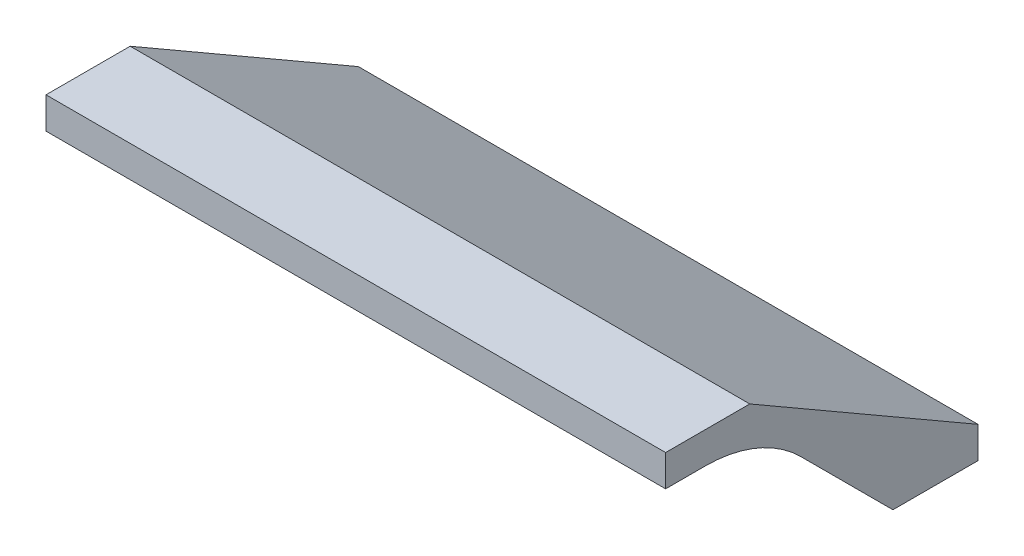
from build123d import *

# Parameters (mm, degrees)
BOSS_EXTRUDE1_DEPTH = 500
CUT_EXTRUDE1_DEPTH  = 570.957034721
SKETCH3_W           = 88.9
SKETCH3_H           = 25.400000016
BOSS_EXTRUDE2_DEPTH = 1
SKETCH4_W           = 88.9
SKETCH4_H           = 25.40000001
BOSS_EXTRUDE3_DEPTH = 1
FILLET1_R           = 109.330995043


with BuildPart() as part:
    # Sketch1 → Boss-Extrude1 (new body)
    with BuildSketch(Plane(origin=(-250, 0, 0), x_dir=(0, -1, 0), z_dir=(-1, 0, 0))):
        Polygon((106.330251065, -252.08113602), (106.330251065, 0), (-25.401284991, 0), (-25.401284991, -67.909513139), (80.930251056, -252.08113602), align=None)
    extrude(amount=-BOSS_EXTRUDE1_DEPTH)

    # Sketch2 → Cut-Extrude1 (cut, through all)
    with BuildSketch(Plane(origin=(250, 0, 0), x_dir=(0, 0, -1), z_dir=(1, 0, 0))):
        Polygon((183.427309509, -106.33025104), (77.097058469, 0), (0, 0), (0, -106.33025104), align=None)
    extrude(amount=-CUT_EXTRUDE1_DEPTH, mode=Mode.SUBTRACT)

    # Sketch3 → Boss-Extrude2 (add)
    with BuildSketch(Plane.XZ):
        with Locations((-95.25, -19.110677533)):
            Rectangle(SKETCH3_W, SKETCH3_H)
    extrude(amount=BOSS_EXTRUDE2_DEPTH)

    # Sketch4 → Boss-Extrude3 (add)
    with BuildSketch(Plane.XZ):
        with Locations((95.25, -19.110677536)):
            Rectangle(SKETCH4_W, SKETCH4_H)
    extrude(amount=BOSS_EXTRUDE3_DEPTH)

    # Fillet1
    fillet1_edges = [part.edges().sort_by_distance(p)[0] for p in [
        (0, 0, -77.097058469),
    ]]
    fillet(fillet1_edges, radius=FILLET1_R - 0.0001)  # a hair under: the kernel refuses the full size


solid = part.part
